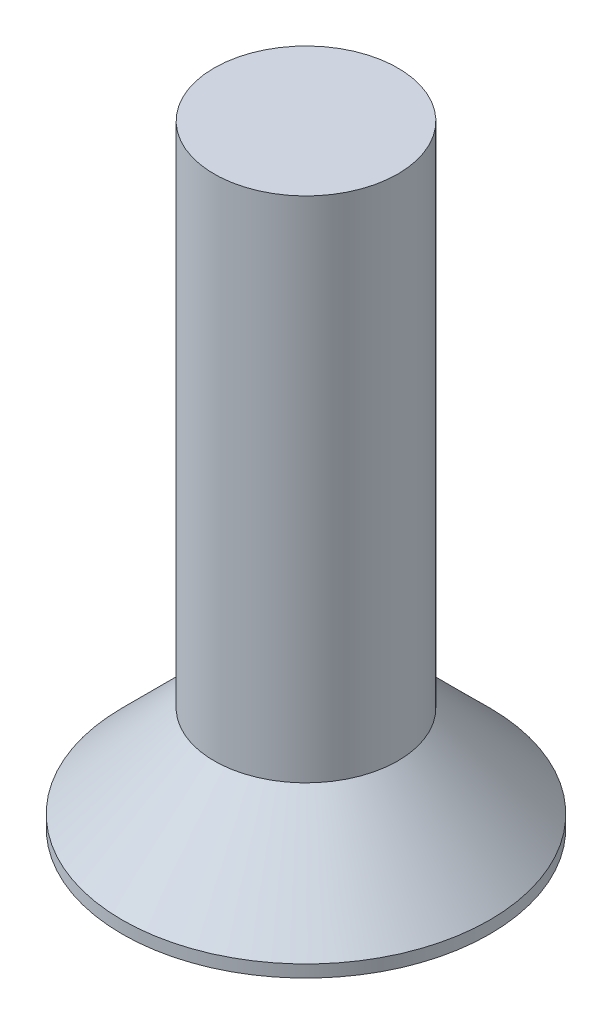
from build123d import *

# Parameters (mm, degrees)
CUT_EXTRUDE1_DEPTH      = 11.862780491
CUT_EXTRUDE1_DEPTH_BACK = 1.5


with BuildPart() as part:
    # Sketch2 → Revolve1 (revolve)
    with BuildSketch(Plane.XY):
        Polygon((3, -0.2), (3, 0), (1.5, 1.5), (1.5, 9.8), (0, 9.8), (0, -0.2), align=None)
    revolve(axis=Axis((0, 1.5, 0), (0, 1, 0)))

    # Sketch3 → Cut-Extrude1 (cut, two sides: drawn at the far end of the back side and taken through both)
    with BuildSketch(Plane.XZ.offset(0.2).offset(-CUT_EXTRUDE1_DEPTH_BACK)):
        Polygon((0, 1.154700538), (-1, 0.577350269), (-1, -0.577350269), (0, -1.154700538), (1, -0.577350269), (1, 0.577350269), align=None)
    extrude(amount=CUT_EXTRUDE1_DEPTH + CUT_EXTRUDE1_DEPTH_BACK, mode=Mode.SUBTRACT)


solid = part.part
